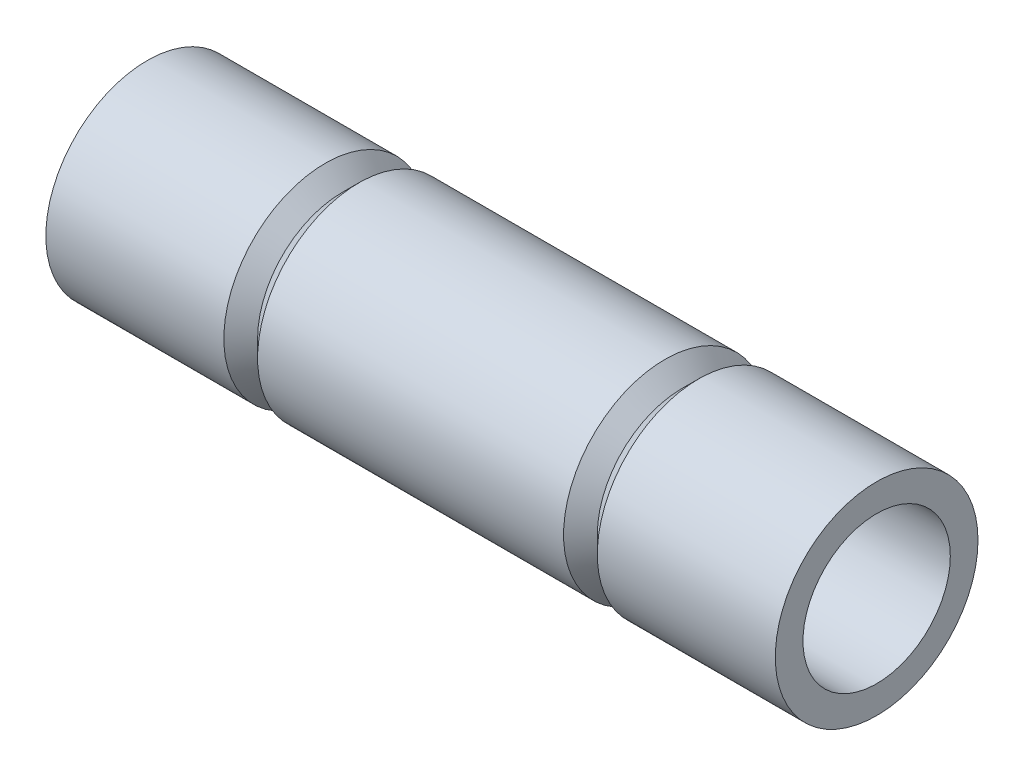
from build123d import *


with BuildPart() as part:
    # Sketch1 → Revolve1 (revolve)
    with BuildSketch(Plane(origin=(0, 0, 0), x_dir=(1, 0, 0), z_dir=(0, 1, 0))):
        Polygon((75.692, -15.2908), (-75.692, -15.2908), (-75.692, -21.034375), (-38.75, -21.034375), (-35.25, -17.534375), (-31.75, -21.034375), (31.75, -21.034375), (35.25, -17.534375), (38.75, -21.034375), (75.692, -21.034375), align=None)
    revolve(axis=Axis((0, 0, 0), (-1, 0, 0)))


solid = part.part
